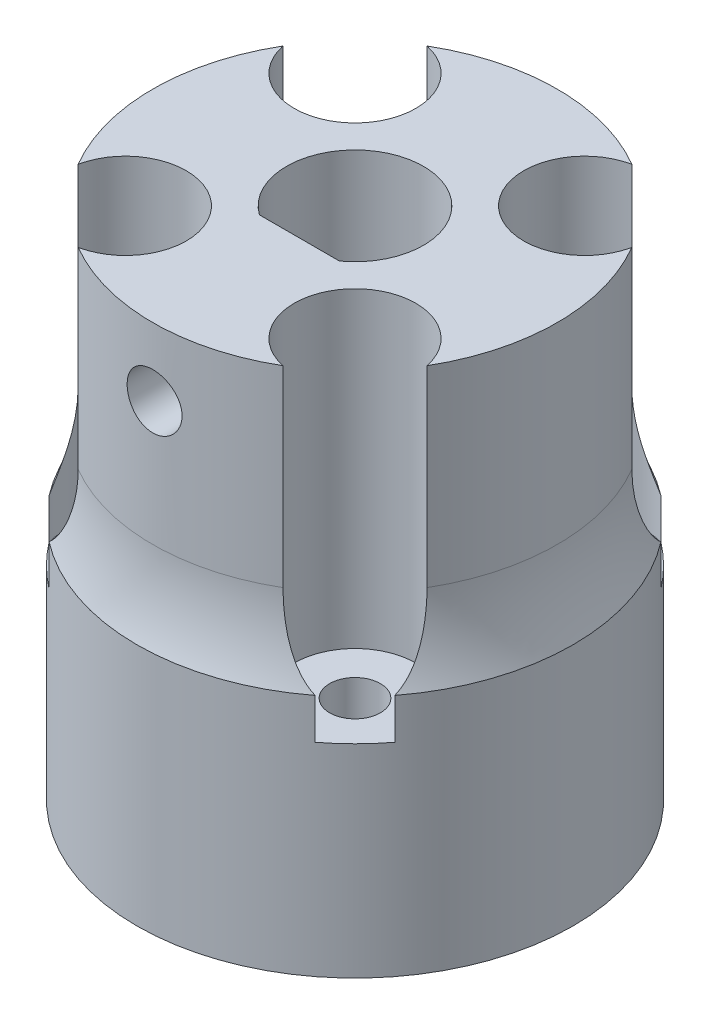
from build123d import *
from build123d.topology import SkipClean

# Parameters (mm, degrees)
SKETCH1_R                      = 10.75
SKETCH1_R_2                    = 1.25
BOSS_EXTRUDE1_DEPTH            = 12
SKETCH14_R                     = 3.25
CUT_EXTRUDE3_DEPTH             = 2.3
CBORE_FOR_M3_SHCS2_D           = 3.4
CBORE_FOR_M3_SHCS2_CBORE_D     = 6.5
CBORE_FOR_M3_SHCS2_CBORE_DEPTH = 3
SKETCH3_R                      = 9.965776233
BOSS_EXTRUDE2_DEPTH            = 20
CUT_EXTRUDE2_REACH             = 37.428
CUT_EXTRUDE1_DEPTH             = 26.122201337
CUT_EXTRUDE1_DEPTH_BACK        = 2
SKETCH2_R                      = 3
SKETCH8_W                      = 1.35255
SKETCH8_H                      = 9.965776233
MOVE_START                     = 5.3
MOVE_FACE1_DEPTH               = 26.7
FILLET1_R                      = 10
CUT_EXTRUDE4_DEPTH             = 36.427743517
CUT_EXTRUDE4_DEPTH_BACK        = 36.427743517
SKETCH15_W                     = 19.931552466
SKETCH15_H                     = 6.64745


# Read off the part's stored shape, not the designer's step: Move Face1
with BuildPart() as part:
    # Sketch1 → Boss-Extrude1 (new body)
    with BuildSketch(Plane(origin=(0, 0, 0), x_dir=(1, 0, 0), z_dir=(0, 1, 0))):
        with Locations(Location((0, 0, 0), (0, 0, 270))):
            Circle(SKETCH1_R)
        with Locations(Location((-5.656854249, 5.656854249, 0), (0, 0, 270))):
            Circle(SKETCH1_R_2, mode=Mode.SUBTRACT)
        with Locations(Location((5.656854249, 5.656854249, 0), (0, 0, 270))):
            Circle(SKETCH1_R_2, mode=Mode.SUBTRACT)
        with Locations(Location((5.656854249, -5.656854249, 0), (0, 0, 270))):
            Circle(SKETCH1_R_2, mode=Mode.SUBTRACT)
        with Locations(Location((-5.656854249, -5.656854249, 0), (0, 0, 270))):
            Circle(SKETCH1_R_2, mode=Mode.SUBTRACT)
    extrude(amount=BOSS_EXTRUDE1_DEPTH)

    # Sketch14 → Cut-Extrude3 (cut)
    with BuildSketch(Plane.XZ):
        with Locations(Location((0, 0, 0), (0, 0, 270))):
            Circle(SKETCH14_R)
    extrude(amount=-CUT_EXTRUDE3_DEPTH, mode=Mode.SUBTRACT)

    # CBORE for M3 SHCS2 (through all)
    with Locations(Plane(origin=(0, 2.3, 0), x_dir=(-1, 0, 0), z_dir=(0, -1, 0))):
        with Locations((0, 0)):
            CounterBoreHole(CBORE_FOR_M3_SHCS2_D / 2, CBORE_FOR_M3_SHCS2_CBORE_D / 2, CBORE_FOR_M3_SHCS2_CBORE_DEPTH)

    # Sketch3 → Boss-Extrude2 (add)
    with BuildSketch(Plane(origin=(0, 12, 0), x_dir=(1, 0, 0), z_dir=(0, 1, 0))):
        with Locations(Location((0, 0, 0), (0, 0, 270))):
            Circle(SKETCH3_R)
    extrude(amount=BOSS_EXTRUDE2_DEPTH)

    # Sketch5 → Cut-Extrude2 (cut, up to next)
    with BuildSketch(Plane(origin=(0, 32, 0), x_dir=(1, 0, 0), z_dir=(0, 1, 0)), mode=Mode.PRIVATE) as cut_extrude2_sk1:
        with BuildLine():
            Line((-1.905, -2.54), (1.905, -2.54))
            ThreePointArc((1.905, -2.54), (0, 3.175), (-1.905, -2.54))
        make_face()
    cut_extrude2_tool1 = extrude(cut_extrude2_sk1.sketch, amount=-CUT_EXTRUDE2_REACH, mode=Mode.PRIVATE) & part.part
    add(cut_extrude2_tool1.solids().sort_by_distance((0, 32, -0.153521))[0], mode=Mode.SUBTRACT)

    # Sketch2 → Cut-Extrude1 (cut, two sides: drawn at the far end of the back side and taken through both)
    with BuildSketch(Plane(origin=(0, 12, 0), x_dir=(1, 0, 0), z_dir=(0, 1, 0)).offset(-CUT_EXTRUDE1_DEPTH_BACK)):
        with Locations((-5.656854249, 5.656854249)):
            Circle(SKETCH2_R)
        with Locations((5.656854249, 5.656854249)):
            Circle(SKETCH2_R)
        with Locations((5.656854249, -5.656854249)):
            Circle(SKETCH2_R)
        with Locations((-5.656854249, -5.656854249)):
            Circle(SKETCH2_R)
    extrude(amount=CUT_EXTRUDE1_DEPTH + CUT_EXTRUDE1_DEPTH_BACK, mode=Mode.SUBTRACT)

    # Sketch8 → Tap Drill for M3x0.5 Tap1 (revolve, cut)
    with BuildSketch(Plane(origin=(0, 22, 0), x_dir=(0, 1, 0), z_dir=(1, 0, 0))):
        with Locations((0.676275, 4.982888117)):
            Rectangle(SKETCH8_W, SKETCH8_H)
    revolve(axis=Axis((0, 22, -6.35), (0, 0, 1)), mode=Mode.SUBTRACT)

    # Move Face1 outline → Move Face1 (cut)
    with BuildSketch(Plane(origin=(0, 0, 0), x_dir=(1, 0, 0), z_dir=(0, 1, 0)).offset(MOVE_START)):
        with BuildLine():
            Line((-1.970539266, -2.74), (1.970539266, -2.74))
            ThreePointArc((1.970539266, -2.74), (0, 3.375), (-1.970539266, -2.74))
        make_face()
        with BuildLine():
            ThreePointArc((-1.905, -2.54), (0, 3.175), (1.905, -2.54))
            Line((1.905, -2.54), (-1.905, -2.54))
        make_face(mode=Mode.SUBTRACT)
    extrude(amount=MOVE_FACE1_DEPTH, mode=Mode.SUBTRACT)

    # Fillet1
    # the kernel refuses this fillet: 10 mm, written as the material it adds along each edge
    with BuildSketch(Plane(origin=(0, 12, 0), x_dir=(0.9978298678102888, 0, -0.06584493075174137), z_dir=(0.06584493075174137, 0, 0.9978298678102888))) as fillet1_piece_1_section:
        with BuildLine():
            CenterArc((19.965776233, 3.881941321), FILLET1_R, 180, 22.842179606)
            Line((9.965776233, 3.881941321), (9.765776233, 3.881941321))
            Line((9.765776233, 3.881941321), (9.765776233, 0))
            Line((9.765776233, 0), (9.965776233, -0.2))
            ThreePointArc((9.965776233, -0.2), (10.357888117, -0.2), (10.565684475, -0.077638826))
            Line((10.565684475, -0.077638826), (10.75, 0))
        make_face()
    fillet1_piece_1 = revolve(axis=Axis((0, 12, 0), (0, 1, 0)), revolution_arc=172.449263909, mode=Mode.PRIVATE)
    fillet1_piece_1 = fillet1_piece_1 - Plane(origin=(-5.656854249, 13.230633789, -5.656854249), x_dir=(1, 0, 0), z_dir=(0, 1, 0)) * Cylinder(3, 44, mode=Mode.PRIVATE)
    fillet1_piece_1 = fillet1_piece_1 - Plane(origin=(5.656854249, 13.230633789, -5.656854249), x_dir=(1, 0, 0), z_dir=(0, 1, 0)) * Cylinder(3, 44, mode=Mode.PRIVATE)
    add(fillet1_piece_1)
    with BuildSketch(Plane(origin=(0, 12, 0), x_dir=(0.06584493075180471, 0, 0.9978298678102845), z_dir=(-0.9978298678102845, 0, 0.06584493075180471))) as fillet1_piece_2_section:
        with BuildLine():
            CenterArc((19.965776233, 3.881941321), FILLET1_R, 180, 22.842179606)
            Line((9.965776233, 3.881941321), (9.765776233, 3.881941321))
            Line((9.765776233, 3.881941321), (9.765776233, 0))
            Line((9.765776233, 0), (9.965776233, -0.2))
            ThreePointArc((9.965776233, -0.2), (10.357888116, -0.2), (10.565684475, -0.077638826))
            Line((10.565684475, -0.077638826), (10.75, 0))
        make_face()
    fillet1_piece_2 = revolve(axis=Axis((0, 12, 0), (0, 1, 0)), revolution_arc=172.449263909, mode=Mode.PRIVATE)
    fillet1_piece_2 = fillet1_piece_2 - Plane(origin=(5.656854249, 13.23063377, 5.656854249), x_dir=(1, 0, 0), z_dir=(0, 1, 0)) * Cylinder(3, 43, mode=Mode.PRIVATE)
    fillet1_piece_2 = fillet1_piece_2 - Plane(origin=(5.656854249, 13.23063377, -5.656854249), x_dir=(1, 0, 0), z_dir=(0, 1, 0)) * Cylinder(3, 43, mode=Mode.PRIVATE)
    add(fillet1_piece_2)
    with BuildSketch(Plane(origin=(0, 12, 0), x_dir=(0.9978298678102888, 0, 0.0658449307517424), z_dir=(0.0658449307517424, 0, -0.9978298678102888))) as fillet1_piece_3_section:
        with BuildLine():
            CenterArc((19.965776233, -3.881941321), FILLET1_R, 157.157820394, 22.842179606)
            Line((9.965776233, -3.881941321), (9.765776233, -3.881941321))
            Line((9.765776233, -3.881941321), (9.765776233, 0))
            Line((9.765776233, 0), (9.965776233, 0.2))
            ThreePointArc((9.965776233, 0.2), (10.357888116, 0.2), (10.565684475, 0.077638826))
            Line((10.565684475, 0.077638826), (10.75, 0))
        make_face()
    fillet1_piece_3 = revolve(axis=Axis((0, 12, 0), (0, -1, 0)), revolution_arc=172.449263909, mode=Mode.PRIVATE)
    fillet1_piece_3 = fillet1_piece_3 - Plane(origin=(5.656854249, 13.230633816, 5.656854249), x_dir=(1, 0, 0), z_dir=(0, 1, 0)) * Cylinder(3, 44, mode=Mode.PRIVATE)
    fillet1_piece_3 = fillet1_piece_3 - Plane(origin=(-5.656854249, 13.230633816, 5.656854249), x_dir=(1, 0, 0), z_dir=(0, 1, 0)) * Cylinder(3, 44, mode=Mode.PRIVATE)
    add(fillet1_piece_3)
    with BuildSketch(Plane(origin=(0, 12, 0), x_dir=(-0.06584493075180468, 0, -0.9978298678102845), z_dir=(0.9978298678102845, 0, -0.06584493075180468))) as fillet1_piece_4_section:
        with BuildLine():
            CenterArc((19.965776233, 3.881941321), FILLET1_R, 180, 22.842179606)
            Line((9.965776233, 3.881941321), (9.765776233, 3.881941321))
            Line((9.765776233, 3.881941321), (9.765776233, 0))
            Line((9.765776233, 0), (9.965776233, -0.2))
            ThreePointArc((9.965776233, -0.2), (10.357888116, -0.2), (10.565684475, -0.077638826))
            Line((10.565684475, -0.077638826), (10.75, 0))
        make_face()
    fillet1_piece_4 = revolve(axis=Axis((0, 12, 0), (0, 1, 0)), revolution_arc=172.449263909, mode=Mode.PRIVATE)
    fillet1_piece_4 = fillet1_piece_4 - Plane(origin=(-5.656854249, 13.23063377, 5.656854249), x_dir=(1, 0, 0), z_dir=(0, 1, 0)) * Cylinder(3, 44, mode=Mode.PRIVATE)
    fillet1_piece_4 = fillet1_piece_4 - Plane(origin=(-5.656854249, 13.23063377, -5.656854249), x_dir=(1, 0, 0), z_dir=(0, 1, 0)) * Cylinder(3, 44, mode=Mode.PRIVATE)
    add(fillet1_piece_4)

    # Sketch15 → Cut-Extrude4 (cut, two sides: drawn at the far end of the back side and taken through both)
    with SkipClean():  # the faces are left unmerged after this step: merging them gives an invalid solid
        with BuildSketch(Plane.XY.offset(-CUT_EXTRUDE4_DEPTH_BACK)):
            with Locations((0, 28.676275)):
                Rectangle(SKETCH15_W, SKETCH15_H)
        extrude(amount=CUT_EXTRUDE4_DEPTH + CUT_EXTRUDE4_DEPTH_BACK, mode=Mode.SUBTRACT)


solid = part.part
